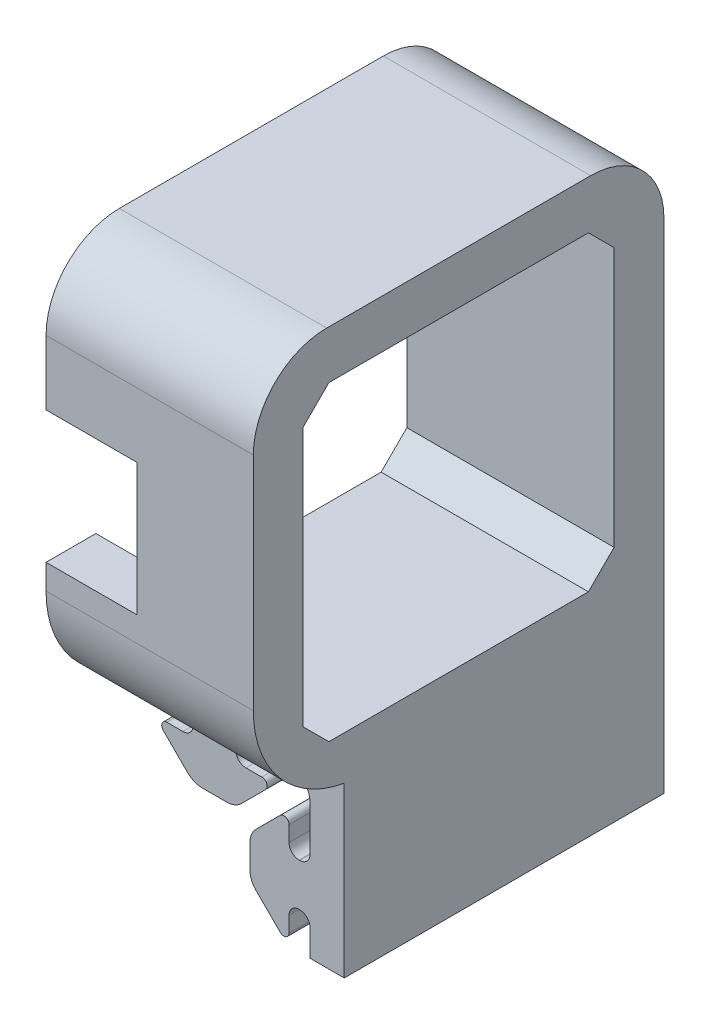
from build123d import *

# Parameters (mm, degrees)
BOSS_EXTRUDE1_DEPTH = 56
SKETCH14_W          = 42.4
SKETCH14_H          = 42.4
CUT_EXTRUDE1_DEPTH  = 56
CHAMFER1_SIZE       = 3.5
FILLET1_R           = 10
SKETCH16_W          = 12.4
SKETCH16_H          = 23
CUT_EXTRUDE3_DEPTH  = 95.009532523
CUT_EXTRUDE4_REACH  = 93.39
SKETCH17_W          = 15.453545708
SKETCH17_H          = 18
FILLET4_R           = 15


with BuildPart() as part:
    # Sketch1 → Boss-Extrude1 (new body)
    with BuildSketch(Plane.XY):
        with BuildLine():
            Line((13.02, -7.9417418), (17.7, -7.9417418))
            Line((17.7, -7.9417418), (17.7, 70.02))
            Line((17.7, 70.02), (-10.566443095, 70.02))
            Line((-10.566443095, 70.02), (-10.566443095, 13.02))
            Line((-10.566443095, 13.02), (-5.317126718, 13.02))
            Line((-5.317126718, 13.02), (-4.287512407, 13.02))
            ThreePointArc((-4.287512407, 13.02), (-3.319474451, 12.619025549), (-2.9185, 11.650987593))
            Line((-2.9185, 11.650987593), (-2.9185, 11.539212407))
            ThreePointArc((-2.9185, 11.539212407), (-3.319474451, 10.571174451), (-4.287512407, 10.1702))
            Line((-4.287512407, 10.1702), (-6.476788598, 10.1702))
            ThreePointArc((-6.476788598, 10.1702), (-7.136510935, 9.729114651), (-6.981020848, 8.950903446))
            Line((-6.981020848, 8.950903446), (-3.672257405, 5.649701928))
            ThreePointArc((-3.672257405, 5.649701928), (-2.746830644, 5.032499411), (-1.655778399, 4.8158))
            Line((-1.655778399, 4.8158), (1.655778399, 4.8158))
            ThreePointArc((1.655778399, 4.8158), (2.746830644, 5.032499411), (3.672257405, 5.649701928))
            Line((3.672257405, 5.649701928), (6.981020848, 8.950903446))
            ThreePointArc((6.981020848, 8.950903446), (7.136510935, 9.729114651), (6.476788598, 10.1702))
            Line((6.476788598, 10.1702), (4.287512407, 10.1702))
            ThreePointArc((4.287512407, 10.1702), (3.319474451, 10.571174451), (2.9185, 11.539212407))
            Line((2.9185, 11.539212407), (2.9185, 11.650987593))
            ThreePointArc((2.9185, 11.650987593), (3.319474451, 12.619025549), (4.287512407, 13.02))
            Line((4.287512407, 13.02), (6.332886163, 13.02))
            Line((6.332886163, 13.02), (10.562594215, 13.019824354))
            ThreePointArc((10.562594215, 13.019824354), (12.303594776, 12.313982883), (13.019956614, 10.577284622))
            Line((13.019956614, 10.577284622), (13.02, 4.287469289))
            ThreePointArc((13.02, 4.287469289), (12.619025549, 3.319431332), (11.650987593, 2.918456882))
            Line((11.650987593, 2.918456882), (11.539212407, 2.918456882))
            ThreePointArc((11.539212407, 2.918456882), (10.571174451, 3.319431332), (10.1702, 4.287469289))
            Line((10.1702, 4.287469289), (10.1702, 6.402089023))
            ThreePointArc((10.1702, 6.402089023), (9.733877283, 7.055496588), (8.963146507, 6.90287605))
            Line((8.963146507, 6.90287605), (5.667020993, 3.614283579))
            ThreePointArc((5.667020993, 3.614283579), (5.046449321, 2.687255303), (4.8285, 1.593185507))
            Line((4.8285, 1.593185507), (4.8285, -1.593185507))
            ThreePointArc((4.8285, -1.593185507), (5.046449321, -2.687255303), (5.667020993, -3.614283579))
            Line((5.667020993, -3.614283579), (8.963146507, -6.90287605))
            ThreePointArc((8.963146507, -6.90287605), (9.733877283, -7.055496588), (10.1702, -6.402089023))
            Line((10.1702, -6.402089023), (10.1702, -4.287469289))
            ThreePointArc((10.1702, -4.287469289), (10.571174451, -3.319431332), (11.539212407, -2.918456882))
            Line((11.539212407, -2.918456882), (11.650987593, -2.918456882))
            ThreePointArc((11.650987593, -2.918456882), (12.619025549, -3.319431332), (13.02, -4.287469289))
            Line((13.02, -4.287469289), (13.02, -5.3170836))
            Line((13.02, -5.3170836), (13.02, -7.9417418))
        make_face()
    extrude(amount=BOSS_EXTRUDE1_DEPTH)

    # Sketch14 → Cut-Extrude1 (cut)
    with BuildSketch(Plane(origin=(17.7, 0, 0), x_dir=(0, 0, -1), z_dir=(1, 0, 0))):
        with Locations((-28, 42.22)):
            Rectangle(SKETCH14_W, SKETCH14_H)
    extrude(amount=-CUT_EXTRUDE1_DEPTH, mode=Mode.SUBTRACT)

    # Chamfer1
    chamfer1_edges = [part.edges().sort_by_distance(p)[0] for p in [
        (3.566778452, 21.02, 49.2),
        (3.566778452, 63.42, 49.2),
        (3.566778452, 63.42, 6.8),
        (3.566778452, 21.02, 6.8),
    ]]
    chamfer(chamfer1_edges, length=CHAMFER1_SIZE)

    # Fillet1
    fillet1_edges = [part.edges().sort_by_distance(p)[0] for p in [
        (3.566778452, 70.02, 56),
        (3.566778452, 70.02, 0),
    ]]
    fillet(fillet1_edges, radius=FILLET1_R)

    # Sketch16 → Cut-Extrude3 (cut, through all)
    with BuildSketch(Plane(origin=(17.7, 0, 0), x_dir=(0, 0, -1), z_dir=(1, 0, 0))):
        with Locations((-49.8, 3.5582582)):
            Rectangle(SKETCH16_W, SKETCH16_H)
    extrude(amount=-CUT_EXTRUDE3_DEPTH, mode=Mode.SUBTRACT)

    # Sketch17 → Cut-Extrude4 (cut, up to next)
    with BuildSketch(Plane.XY.offset(56), mode=Mode.PRIVATE) as cut_extrude4_sk1:
        with Locations((-5.893215949, 42.22)):
            Rectangle(SKETCH17_W, SKETCH17_H)
    cut_extrude4_tool1 = extrude(cut_extrude4_sk1.sketch, amount=-CUT_EXTRUDE4_REACH, mode=Mode.PRIVATE) & part.part
    add(cut_extrude4_tool1.solids().sort_by_distance((-5.893216, 42.22, 56))[0], mode=Mode.SUBTRACT)

    # Fillet4
    # the kernel refuses this fillet: 15 mm, written as the material it takes off along each edge
    with BuildSketch(Plane(origin=(54.632370625, 15.0582582, 56), x_dir=(0, 1, 0), z_dir=(-1, 0, 0))) as fillet4_piece_1:
        with BuildLine():
            CenterArc((14.77294825, 15), FILLET4_R, 189.98168298, 80.01831702)
            Line((0, 12.4), (-0.295458965, 12.348))
            ThreePointArc((-0.295458965, 12.348), (-0.3, 6.2), (-0.3, 0))
            Line((-0.3, 0), (0, -0.3))
            Line((0, -0.3), (14.77294825, -0.3))
            Line((14.77294825, -0.3), (14.77294825, 0))
        make_face()
    extrude(amount=102.131184346, mode=Mode.SUBTRACT)


solid = part.part
